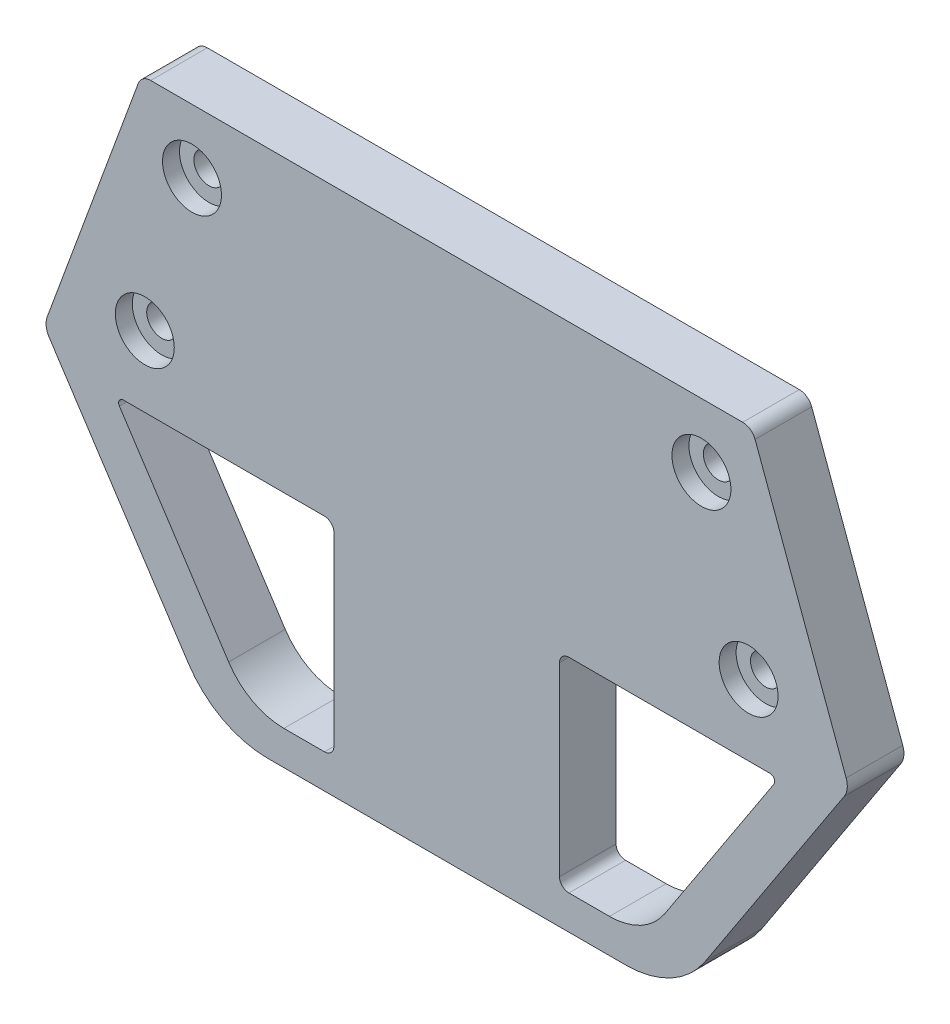
from build123d import *

# Parameters (mm, degrees)
BOSS_EXTRUDE1_DEPTH = 7.62
CUT_EXTRUDE4_DEPTH  = 66.817003284
SKETCH8_R           = 2.032
CUT_EXTRUDE6_DEPTH  = 66.817003284
SKETCH9_R           = 3.96875
CUT_EXTRUDE7_DEPTH  = 2.286
SKETCH11_R          = 2.032
CUT_EXTRUDE9_DEPTH  = 25.4


with BuildPart() as part:
    # Sketch2 → Boss-Extrude1 (new body)
    with BuildSketch(Plane.XY):
        with BuildLine():
            Line((-53.772682586, -0.315391152), (-41.513343753, 33.030010472))
            ThreePointArc((-41.513343753, 33.030010472), (-40.862007104, 33.874587748), (-39.844551085, 34.194483756))
            Line((-39.844551085, 34.194483756), (39.844551085, 34.194483756))
            ThreePointArc((39.844551085, 34.194483756), (40.862007104, 33.874587748), (41.513343753, 33.030010472))
            Line((41.513343753, 33.030010472), (53.772682586, -0.315391152))
            ThreePointArc((53.772682586, -0.315391152), (53.912335076, -1.479661595), (53.514124144, -2.582592481))
            Line((53.514124144, -2.582592481), (34.799691691, -31.183474844))
            ThreePointArc((34.799691691, -31.183474844), (30.194805402, -35.418112764), (24.13, -36.952802142))
            Line((24.13, -36.952802142), (-24.13, -36.952802142))
            ThreePointArc((-24.13, -36.952802142), (-30.194805402, -35.418112764), (-34.799691691, -31.183474844))
            Line((-34.799691691, -31.183474844), (-53.514124144, -2.582592481))
            ThreePointArc((-53.514124144, -2.582592481), (-53.912335076, -1.479661595), (-53.772682586, -0.315391152))
        make_face()
    extrude(amount=BOSS_EXTRUDE1_DEPTH)

    # Sketch6 → Cut-Extrude4 (cut, through all)
    with BuildSketch(Plane.XY.offset(7.62)):
        with BuildLine():
            Line((-44.056637344, -5.881169679), (-29.353866797, -28.351111628))
            ThreePointArc((-29.353866797, -28.351111628), (-26.143297026, -31.303540775), (-21.914858001, -32.373540556))
            Line((-21.914858001, -32.373540556), (-16.452977044, -32.373540556))
            ThreePointArc((-16.452977044, -32.373540556), (-15.554951432, -32.001566168), (-15.182977044, -31.103540556))
            Line((-15.182977044, -31.103540556), (-15.182977044, -6.168486031))
            ThreePointArc((-15.182977044, -6.168486031), (-15.554951432, -5.270460419), (-16.452977044, -4.898486031))
            Line((-16.452977044, -4.898486031), (-43.525279573, -4.898486031))
            ThreePointArc((-43.525279573, -4.898486031), (-44.083851017, -5.231454672), (-44.056637344, -5.881169679))
        make_face()
        with BuildLine():
            Line((16.452977044, -32.373540556), (21.914858001, -32.373540556))
            ThreePointArc((21.914858001, -32.373540556), (26.143297026, -31.303540775), (29.353866797, -28.351111628))
            Line((29.353866797, -28.351111628), (44.056637344, -5.881169679))
            ThreePointArc((44.056637344, -5.881169679), (44.083851017, -5.231454672), (43.525279573, -4.898486031))
            Line((43.525279573, -4.898486031), (16.452977044, -4.898486031))
            ThreePointArc((16.452977044, -4.898486031), (15.554951432, -5.270460419), (15.182977044, -6.168486031))
            Line((15.182977044, -6.168486031), (15.182977044, -31.103540556))
            ThreePointArc((15.182977044, -31.103540556), (15.554951432, -32.001566168), (16.452977044, -32.373540556))
        make_face()
    extrude(amount=-CUT_EXTRUDE4_DEPTH, mode=Mode.SUBTRACT)

    # Sketch8 → Cut-Extrude6 (cut, through all)
    with BuildSketch(Plane.XY.offset(7.62)):
        with Locations((-40.64, 4.626513969)):
            Circle(SKETCH8_R)
        with Locations((-34.29, 25.581513969)):
            Circle(SKETCH8_R)
        with Locations((40.64, 4.626513969)):
            Circle(SKETCH8_R)
        with Locations((34.29, 25.581513969)):
            Circle(SKETCH8_R)
    extrude(amount=-CUT_EXTRUDE6_DEPTH, mode=Mode.SUBTRACT)

    # Sketch9 → Cut-Extrude7 (cut)
    with BuildSketch(Plane.XY.offset(7.62)):
        with Locations((-40.64, 4.626513969)):
            Circle(SKETCH9_R)
        with Locations((-34.29, 25.581513969)):
            Circle(SKETCH9_R)
        with Locations((40.64, 4.626513969)):
            Circle(SKETCH9_R)
        with Locations((34.29, 25.581513969)):
            Circle(SKETCH9_R)
    extrude(amount=-CUT_EXTRUDE7_DEPTH, mode=Mode.SUBTRACT)

    # Sketch11 → Cut-Extrude9 (cut)
    with BuildSketch(Plane.XZ.offset(36.952802142)):
        with Locations((0, 3.81)):
            Circle(SKETCH11_R)
    extrude(amount=-CUT_EXTRUDE9_DEPTH, mode=Mode.SUBTRACT)


solid = part.part
